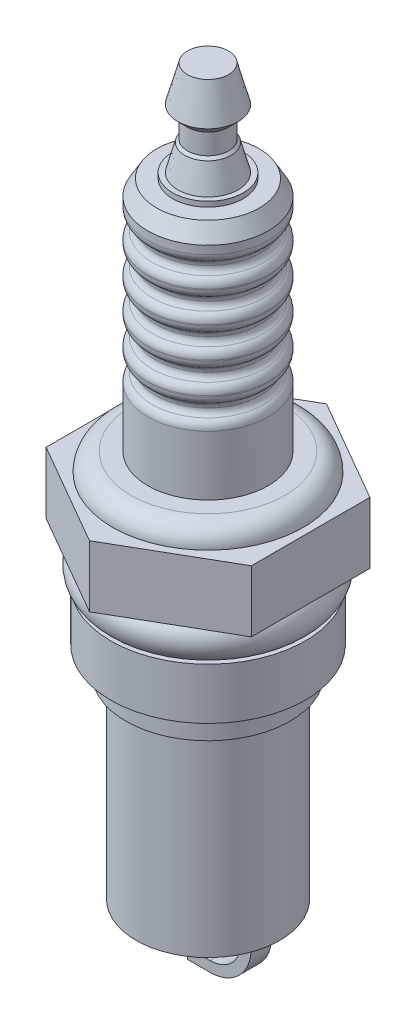
from build123d import *

# Parameters (mm, degrees)
CUT_EXTRUDE1_START  = -17
SKETCH2_R           = 3.75
SKETCH2_R_2         = 2
CUT_EXTRUDE1_DEPTH  = 17
FILLET1_R           = 0.5
FILLET2_R           = 0.74
FILLET3_R           = 1
FILLET4_R           = 1.8
BOSS_EXTRUDE1_DEPTH = 1
SKETCH6_OUTSIDE_W   = 43.254
SKETCH6_OUTSIDE_H   = 43.254
CUT_EXTRUDE2_DEPTH  = 6


with BuildPart() as part:
    # Sketch1 → Revolve1 (revolve)
    with BuildSketch(Plane(origin=(0, 0, 0), x_dir=(0, 0, -1), z_dir=(1, 0, 0))):
        with BuildLine():
            Line((0, 0), (0.5, 0))
            Line((0.5, 0), (0.5, 0.5))
            Line((0.5, 0.5), (0.75, 0.75))
            Line((0.75, 0.75), (0.75, 1.59603925))
            Line((0.75, 1.59603925), (2, 1.59603925))
            Line((2, 1.59603925), (2, 2.59603925))
            Line((2, 2.59603925), (7, 2.59603925))
            Line((7, 2.59603925), (7, 21.59603925))
            Line((7, 21.59603925), (8, 21.59603925))
            Line((8, 21.59603925), (8, 24.09603925))
            Line((8, 24.09603925), (9.468245837, 24.09603925))
            Line((9.468245837, 24.09603925), (9.468245837, 29.09603925))
            Line((9.468245837, 29.09603925), (8.968245837, 29.09603925))
            ThreePointArc((8.968245837, 29.09603925), (10, 30.84603925), (8.968245837, 32.59603925))
            Line((8.968245837, 32.59603925), (12.3, 32.59603925))
            Line((12.3, 32.59603925), (12.3, 38.59603925))
            Line((12.3, 38.59603925), (9.3, 38.59603925))
            Line((9.3, 38.59603925), (9.3, 40.39603925))
            Line((9.3, 40.39603925), (0, 40.39603925))
            Line((0, 40.39603925), (0, 0))
        make_face()
    revolve(axis=Axis((0, 0, 0), (0, 1, 0)))

    # Sketch2 → Cut-Extrude1 (cut)
    with BuildSketch(Plane.XZ.offset(-2.59603925).offset(CUT_EXTRUDE1_START)):
        with Locations(Location((0, 0, 0), (0, 0, 270))):
            Circle(SKETCH2_R)
        with Locations(Location((0, 0, 0), (0, 0, 270))):
            Circle(SKETCH2_R_2, mode=Mode.SUBTRACT)
    extrude(amount=CUT_EXTRUDE1_DEPTH, mode=Mode.SUBTRACT)

    # Fillet1
    fillet1_edges = [part.edges().sort_by_distance(p)[0] for p in [
        (0, 1.59603925, 2),
    ]]
    fillet(fillet1_edges, radius=FILLET1_R)

    # Sketch3 → Revolve2 (revolve)
    with BuildSketch(Plane(origin=(0, 0, 0), x_dir=(0, 0, -1), z_dir=(1, 0, 0)), mode=Mode.PRIVATE) as revolve2_sk:
        Polygon((0, 40.39603925), (5.866025404, 40.39603925), (5.866025404, 46.89603925), (5.106025404, 46.89603925), (5.106025404, 48.39603925), (5.866025404, 48.39603925), (5.866025404, 49.89603925), (5.106025404, 49.89603925), (5.106025404, 51.39603925), (5.866025404, 51.39603925), (5.866025404, 52.89603925), (5.106025404, 52.89603925), (5.106025404, 54.39603925), (5.866025404, 54.39603925), (5.866025404, 55.89603925), (5.106025404, 55.89603925), (5.106025404, 57.39603925), (5.866025404, 57.39603925), (5.866025404, 58.89603925), (5.106025404, 58.89603925), (5.106025404, 60.39603925), (5.866025404, 60.39603925), (5.866025404, 61.89603925), (5, 63.39603925), (3.437822174, 63.39603925), (3.437822174, 63.89603925), (2.937822174, 63.89603925), (2.25, 66.463026548), (2, 66.713026548), (2, 68.713026548), (2.937822174, 69.650848722), (2, 73.150848722), (0, 73.150848722), align=None)
    revolve(revolve2_sk.sketch.rotate(Axis((0, 73.150848722, 0), (0, -1, 0)), 180), axis=Axis((0, 73.150848722, 0), (0, -1, 0)))

    # Fillet2
    fillet2_edges = [part.edges().sort_by_distance(p)[0] for p in [
        (0, 46.89603925, -5.106025404),
        (0, 48.39603925, -5.106025404),
        (0, 49.89603925, -5.106025404),
        (0, 51.39603925, -5.106025404),
        (0, 52.89603925, -5.106025404),
        (0, 54.39603925, -5.106025404),
        (0, 55.89603925, -5.106025404),
        (0, 57.39603925, -5.106025404),
        (0, 58.89603925, -5.106025404),
        (0, 60.39603925, -5.106025404),
    ]]
    fillet(fillet2_edges, radius=FILLET2_R)

    # Fillet3
    fillet3_edges = [part.edges().sort_by_distance(p)[0] for p in [
        (0, 46.89603925, -5.866025404),
        (0, 49.89603925, -5.866025404),
        (0, 51.39603925, -5.866025404),
        (0, 52.89603925, -5.866025404),
        (0, 54.39603925, -5.866025404),
        (0, 55.89603925, -5.866025404),
        (0, 58.89603925, -5.866025404),
        (0, 57.39603925, -5.866025404),
        (0, 60.39603925, -5.866025404),
        (0, 48.39603925, -5.866025404),
    ]]
    fillet(fillet3_edges, radius=FILLET3_R)

    # Fillet4
    fillet4_edges = [part.edges().sort_by_distance(p)[0] for p in [
        (0, 40.39603925, 9.3),
    ]]
    fillet(fillet4_edges, radius=FILLET4_R - 0.0001)  # a hair under: the kernel refuses the full size

    # Sketch5 → Boss-Extrude1 (add, symmetric)
    with BuildSketch(Plane.XY):
        with BuildLine():
            Line((4.2, 2.59603925), (4.2, 1.5))
            ThreePointArc((4.2, 1.5), (3.321320344, -0.621320344), (1.2, -1.5))
            Line((1.2, -1.5), (-0.98, -1.5))
            Line((-0.98, -1.5), (-0.98, -2.5))
            Line((-0.98, -2.5), (1.2, -2.5))
            ThreePointArc((1.2, -2.5), (4.028427125, -1.328427125), (5.2, 1.5))
            Line((5.2, 1.5), (5.2, 2.59603925))
            Line((5.2, 2.59603925), (4.2, 2.59603925))
        make_face()
    extrude(amount=BOSS_EXTRUDE1_DEPTH, both=True)

    # Sketch6 outside → Cut-Extrude2 (cut)
    with BuildSketch(Plane(origin=(0, 38.59603925, 0), x_dir=(1, 0, 0), z_dir=(0, 1, 0))):
        Rectangle(SKETCH6_OUTSIDE_W, SKETCH6_OUTSIDE_H)
        Polygon((0, -11.547005384), (10, -5.773502692), (10, 5.773502692), (0, 11.547005384), (-10, 5.773502692), (-10, -5.773502692), align=None, mode=Mode.SUBTRACT)
    extrude(amount=-CUT_EXTRUDE2_DEPTH, mode=Mode.SUBTRACT)


solid = part.part
